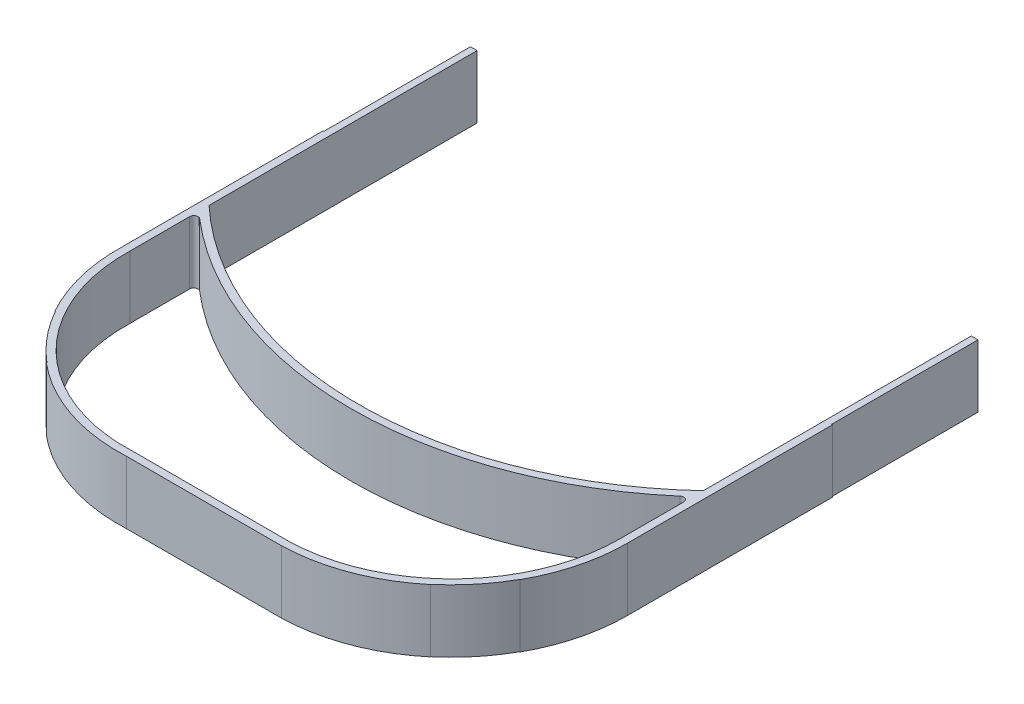
from build123d import *

# Parameters (mm, degrees)
EXTRUDE_THIN1_DEPTH = 19.05
CUT_EXTRUDE1_DEPTH  = 0.762
SKETCH5_W           = 0.254
SKETCH5_H           = 44.45
CUT_EXTRUDE2_DEPTH  = 179.757350667
FILLET1_R           = 1.27


# Read off the part's stored shape, not the designer's step: Extrude-Thin1
with BuildPart() as part:
    # Extrude-Thin1 outline → Extrude-Thin1 (new body)
    with BuildSketch(Plane(origin=(0, 0, 0), x_dir=(1, 0, 0), z_dir=(0, 1, 0))):
        with BuildLine():
            Line((-77.343, 0), (-77.343, -105.395106316))
            ThreePointArc((-77.343, -105.395106316), (-61.336250036, -144.849828705), (-21.528670477, -159.957699927))
            Line((-21.528670477, -159.957699927), (25.447975811, -159.957699927))
            ThreePointArc((25.447975811, -159.957699927), (62.222233314, -143.899011044), (77.343, -106.729266381))
            Line((77.343, -106.729266381), (77.343, 0))
            Line((77.343, 0), (75.057, 0))
            Line((75.057, 0), (75.057, -81.420653026))
            ThreePointArc((75.057, -81.420653026), (0, -111.057919203), (-75.057, -81.420653026))
            Line((-75.057, -81.420653026), (-75.057, 0))
            Line((-75.057, 0), (-77.343, 0))
        make_face()
        with BuildLine():
            ThreePointArc((-75.057, -84.523738539), (0, -113.343919203), (75.057, -84.523738539))
            Line((75.057, -84.523738539), (75.057, -106.729266381))
            ThreePointArc((75.057, -106.729266381), (60.595423897, -142.292928246), (25.418661536, -157.671699927))
            Line((25.418661536, -157.671699927), (-21.584839631, -157.671699927))
            ThreePointArc((-21.584839631, -157.671699927), (-59.729066599, -143.224119864), (-75.057, -105.425057993))
            Line((-75.057, -105.425057993), (-75.057, -84.523738539))
        make_face(mode=Mode.SUBTRACT)
    extrude(amount=EXTRUDE_THIN1_DEPTH)

    # Sketch4 → Cut-Extrude1 (cut, symmetric)
    # profile 1 of 11: a face of its own
    with BuildSketch(Plane.ZY.offset(77.343)):
        Polygon((64.086153846, 12.7), (66.561025641, 12.7), (66.561025641, 11.788205128), (64.997948718, 11.788205128), (64.997948718, 10.811282051), (66.561025641, 10.811282051), (66.561025641, 9.899487179), (64.997948718, 9.899487179), (64.997948718, 7.62), (64.086153846, 7.62), align=None)
    # profile 2 of 11: a face of its own
    with BuildSketch(Plane.ZY.offset(77.343)):
        with BuildLine():
            Line((67.472820513, 12.7), (68.535224359, 12.7))
            add(Edge.make_bspline(
                [(68.535224359, 12.7), (68.60544893, 12.699750743), (68.740510561, 12.699271352), (68.935262056, 12.691707827), (69.114168086, 12.681182562), (69.27749354, 12.665120728), (69.425168542, 12.643824678), (69.557341098, 12.618720159), (69.674007345, 12.590108177), (69.776151201, 12.55445539), (69.868330981, 12.514239587), (69.954255351, 12.468030891), (70.03581993, 12.416343853), (70.112479549, 12.357818444), (70.184900396, 12.293507524), (70.253219098, 12.223346356), (70.316470249, 12.146740004), (70.374262194, 12.064172522), (70.426934901, 11.977313424), (70.473486526, 11.886043452), (70.511342385, 11.790299134), (70.544792094, 11.691464182), (70.568884836, 11.588125732), (70.585640986, 11.481289801), (70.597909183, 11.370580314), (70.598614546, 11.295369204), (70.598974359, 11.257003205)],
                knots=[0, 0, 0, 0, 1.749336639, 3.364467119, 4.854658419, 6.213483162, 7.451590619, 8.570285859, 9.5643256, 10.440900261, 11.26203566, 12.067320669, 12.869050712, 13.665104639, 14.467235401, 15.27997916, 16.102287765, 16.939272006, 17.78853747, 18.631303466, 19.488103222, 20.351255419, 21.228522269, 22.127379805, 23.044756219, 24, 24, 24, 24], degree=3))
            add(Edge.make_bspline(
                [(70.598974359, 11.257003205), (70.598039694, 11.216957916), (70.596206986, 11.138436401), (70.586335024, 11.023094701), (70.568292179, 10.91274383), (70.540963665, 10.807706882), (70.509553088, 10.706676549), (70.467785077, 10.611516906), (70.42064575, 10.520843991), (70.364659747, 10.435940409), (70.303217844, 10.354920281), (70.231762204, 10.280887788), (70.154922054, 10.209863965), (70.06837793, 10.146297503), (69.975944776, 10.085890267), (69.875786044, 10.031145224), (69.768555404, 9.98068621), (69.693166953, 9.952546778), (69.654615385, 9.938157051)],
                knots=[0, 0, 0, 0, 1.099860209, 2.156625411, 3.176576793, 4.16617041, 5.135385252, 6.078461593, 7.016046972, 7.938469504, 8.868247731, 9.803980173, 10.76021508, 11.73834243, 12.748633912, 13.790971185, 14.870363756, 16, 16, 16, 16], degree=3))
            Line((69.654615385, 9.938157051), (70.826923077, 7.62))
            Line((70.826923077, 7.62), (69.813365385, 7.62))
            Line((69.813365385, 7.62), (68.693974359, 9.834358974))
            Line((68.693974359, 9.834358974), (68.384615385, 9.834358974))
            Line((68.384615385, 9.834358974), (68.384615385, 7.62))
            Line((68.384615385, 7.62), (67.472820513, 7.62))
            Line((67.472820513, 7.62), (67.472820513, 12.7))
        make_face()
        with BuildLine():
            Line((68.384615385, 10.746153846), (68.739767628, 10.746153846))
            add(Edge.make_bspline(
                [(68.739767628, 10.746153846), (68.783187942, 10.746642875), (68.866328514, 10.74757926), (68.985895575, 10.751922602), (69.094490982, 10.762387909), (69.19258108, 10.775610434), (69.280659449, 10.790877748), (69.357940462, 10.812756737), (69.425614901, 10.836200627), (69.48288082, 10.8653353), (69.531807506, 10.898467744), (69.574052568, 10.936107023), (69.608995291, 10.979669695), (69.637754935, 11.027971917), (69.660126811, 11.081440907), (69.676456566, 11.139489699), (69.685582485, 11.202779542), (69.686632453, 11.246458151), (69.687179487, 11.269214744)],
                knots=[0, 0, 0, 0, 1.688639943, 3.233382647, 4.650958383, 5.928841754, 7.082724185, 8.122798841, 9.049171256, 9.863274652, 10.613301712, 11.341792392, 12.054588806, 12.776240173, 13.521029143, 14.301969904, 15.115324896, 16, 16, 16, 16], degree=3))
            add(Edge.make_bspline(
                [(69.687179487, 11.269214744), (69.686145269, 11.296137453), (69.684113739, 11.349022128), (69.663954648, 11.425157516), (69.631865729, 11.495626026), (69.587880611, 11.560109265), (69.532487074, 11.616639723), (69.468918619, 11.666471773), (69.395803286, 11.705875229), (69.32810399, 11.731865329), (69.266513455, 11.747415474), (69.21092994, 11.759003304), (69.146563895, 11.767215932), (69.073366727, 11.775926886), (68.991525018, 11.781575499), (68.900592682, 11.78569786), (68.800830876, 11.787384521), (68.731287423, 11.787923717), (68.694991987, 11.788205128)],
                knots=[0, 0, 0, 0, 1.020303359, 2.004196876, 2.966617323, 3.9489082, 4.950758222, 5.960522915, 7.003732012, 8.091992268, 8.70421221, 9.413913587, 10.24622431, 11.166358409, 12.212345909, 13.359657661, 14.621978493, 16, 16, 16, 16], degree=3))
            Line((68.694991987, 11.788205128), (68.384615385, 11.788205128))
            Line((68.384615385, 11.788205128), (68.384615385, 10.746153846))
        make_face(mode=Mode.SUBTRACT)
    # profile 3 of 11: a face of its own
    with BuildSketch(Plane.ZY.offset(77.343)):
        Polygon((71.575897436, 12.7), (74.311282051, 12.7), (74.311282051, 11.788205128), (72.487692308, 11.788205128), (72.487692308, 10.811282051), (74.311282051, 10.811282051), (74.311282051, 9.899487179), (72.487692308, 9.899487179), (72.487692308, 8.531794872), (74.311282051, 8.531794872), (74.311282051, 7.62), (71.575897436, 7.62), align=None)
    # profile 4 of 11: a face of its own
    with BuildSketch(Plane.ZY.offset(77.343)):
        with BuildLine():
            Line((77.828205128, 12.021241987), (77.146394231, 11.397435897))
            add(Edge.make_bspline(
                [(77.146394231, 11.397435897), (77.117188375, 11.438633793), (77.061117206, 11.517728006), (76.970231689, 11.623637022), (76.879756567, 11.713985295), (76.788853642, 11.78839539), (76.696717186, 11.846415212), (76.603507135, 11.887493886), (76.509751921, 11.913607989), (76.44676289, 11.916859824), (76.415737179, 11.918461538)],
                knots=[0, 0, 0, 0, 1.299362458, 2.494594718, 3.587462134, 4.587049575, 5.512617175, 6.380583204, 7.202344345, 8, 8, 8, 8], degree=3))
            add(Edge.make_bspline(
                [(76.415737179, 11.918461538), (76.386797287, 11.917446618), (76.330921957, 11.915487075), (76.251267529, 11.896009355), (76.180549193, 11.862393671), (76.118835968, 11.818438335), (76.069949989, 11.765482347), (76.030918326, 11.709945132), (76.008940219, 11.648644606), (76.006047468, 11.606540932), (76.004615385, 11.585697115)],
                knots=[0, 0, 0, 0, 1.185010067, 2.2879431, 3.333075148, 4.379039566, 5.372662701, 6.27520591, 7.14612461, 8, 8, 8, 8], degree=3))
            add(Edge.make_bspline(
                [(76.004615385, 11.585697115), (76.005512799, 11.564552722), (76.007320066, 11.521970852), (76.024775808, 11.459561819), (76.051086595, 11.398580928), (76.076227627, 11.361458959), (76.089078526, 11.342483974)],
                knots=[0, 0, 0, 0, 0.967525499, 1.948461899, 2.951351359, 4, 4, 4, 4], degree=3))
            add(Edge.make_bspline(
                [(76.089078526, 11.342483974), (76.100761383, 11.327734918), (76.127653777, 11.293784537), (76.178932065, 11.240012426), (76.243326826, 11.174136884), (76.323316104, 11.098423176), (76.415579326, 11.010148343), (76.524393012, 10.912782501), (76.646625027, 10.803310344), (76.733504712, 10.727077898), (76.779030449, 10.68713141)],
                knots=[0, 0, 0, 0, 0.473873513, 1.090794244, 1.870441696, 2.795289791, 3.865433203, 5.087734844, 6.473946851, 8, 8, 8, 8], degree=3))
            add(Edge.make_bspline(
                [(76.779030449, 10.68713141), (76.821762901, 10.650148628), (76.902860219, 10.57996299), (77.018245597, 10.480345747), (77.119650127, 10.390722542), (77.208551041, 10.312438428), (77.283600689, 10.244672026), (77.34511458, 10.187099412), (77.393844001, 10.14084142), (77.421543823, 10.112901565), (77.433365385, 10.100977564)],
                knots=[0, 0, 0, 0, 1.543621617, 2.929473131, 4.163658386, 5.240097082, 6.164993805, 6.925417477, 7.541396219, 8, 8, 8, 8], degree=3))
            add(Edge.make_bspline(
                [(77.433365385, 10.100977564), (77.478213924, 10.052441839), (77.564428568, 9.95913913), (77.676477212, 9.814549275), (77.76869687, 9.673400093), (77.840039747, 9.533035635), (77.893920756, 9.391430721), (77.931907582, 9.245112497), (77.954658145, 9.092552029), (77.957183988, 8.988448135), (77.958461538, 8.935793269)],
                knots=[0, 0, 0, 0, 1.206664779, 2.319633467, 3.337109185, 4.282041471, 5.190008762, 6.099243693, 7.03861361, 8, 8, 8, 8], degree=3))
            add(Edge.make_bspline(
                [(77.958461538, 8.935793269), (77.957552211, 8.88448756), (77.955768076, 8.78382385), (77.93391585, 8.636517505), (77.902755858, 8.495538939), (77.854577044, 8.362422199), (77.795856991, 8.234982214), (77.722242923, 8.115204094), (77.635793295, 8.001875635), (77.536708747, 7.897022722), (77.427109472, 7.801875971), (77.309553833, 7.717174087), (77.182892311, 7.647241892), (77.048207085, 7.589657717), (76.905570246, 7.545305616), (76.755151719, 7.51252528), (76.596721429, 7.492851039), (76.488384513, 7.49079433), (76.433036859, 7.48974359)],
                knots=[0, 0, 0, 0, 1.043214005, 2.046824704, 3.02475056, 3.976699089, 4.921714032, 5.875962561, 6.831408892, 7.817874052, 8.806269674, 9.781291748, 10.760897367, 11.74438705, 12.757449933, 13.795994037, 14.874007457, 16, 16, 16, 16], degree=3))
            add(Edge.make_bspline(
                [(76.433036859, 7.48974359), (76.389589422, 7.490514376), (76.30353858, 7.492040975), (76.176712647, 7.504504388), (76.054247873, 7.524619009), (75.936282202, 7.553449271), (75.822284178, 7.589981122), (75.712249119, 7.634603379), (75.606936635, 7.68800767), (75.505549881, 7.74909579), (75.408581721, 7.820027144), (75.314806031, 7.899351564), (75.225154281, 7.988289095), (75.139195891, 8.086629403), (75.057480848, 8.194650964), (74.977334324, 8.310849378), (74.902318272, 8.43738113), (74.85597752, 8.526144178), (74.832307692, 8.571482372)],
                knots=[0, 0, 0, 0, 1.016823716, 2.013894106, 2.979844003, 3.91962641, 4.853723003, 5.779685073, 6.695824784, 7.614987388, 8.547259901, 9.504950863, 10.487499108, 11.500346958, 12.559593716, 13.656357062, 14.802919212, 16, 16, 16, 16], degree=3))
            Line((74.832307692, 8.571482372), (75.634198718, 9.052820513))
            add(Edge.make_bspline(
                [(75.634198718, 9.052820513), (75.663806135, 9.001355739), (75.720566083, 8.902693368), (75.816751121, 8.770127968), (75.915287782, 8.656607646), (76.018454146, 8.564138883), (76.124995747, 8.49148525), (76.235427207, 8.439561923), (76.349826113, 8.407421443), (76.427749451, 8.403496348), (76.46661859, 8.401538462)],
                knots=[0, 0, 0, 0, 1.283663364, 2.460892379, 3.537111102, 4.529833553, 5.449777664, 6.316464042, 7.160231139, 8, 8, 8, 8], degree=3))
            add(Edge.make_bspline(
                [(76.46661859, 8.401538462), (76.506154068, 8.403137378), (76.582858655, 8.406239509), (76.692344637, 8.434892954), (76.792725531, 8.479880966), (76.879494035, 8.544072654), (76.952964133, 8.61815962), (77.007189282, 8.700584756), (77.041253887, 8.789766764), (77.044855341, 8.851718453), (77.046666667, 8.882876603)],
                knots=[0, 0, 0, 0, 1.13588714, 2.203786484, 3.234766741, 4.283437687, 5.291419208, 6.222934724, 7.106237994, 8, 8, 8, 8], degree=3))
            add(Edge.make_bspline(
                [(77.046666667, 8.882876603), (77.044993982, 8.91186419), (77.041596083, 8.9707497), (77.016568206, 9.058302984), (76.977442001, 9.145816451), (76.931152941, 9.217597364), (76.884048027, 9.277697576), (76.839005104, 9.329771692), (76.784154739, 9.387304473), (76.719636009, 9.450368292), (76.646301374, 9.519518314), (76.56408906, 9.59474777), (76.472057647, 9.675393977), (76.407009663, 9.730329377), (76.372996795, 9.759054487)],
                knots=[0, 0, 0, 0, 0.916159276, 1.861089862, 2.860218735, 3.940849679, 4.552606315, 5.27541173, 6.11797699, 7.06649574, 8.129236253, 9.306560635, 10.591630461, 12, 12, 12, 12], degree=3))
            add(Edge.make_bspline(
                [(76.372996795, 9.759054487), (76.308336978, 9.813762893), (76.184235218, 9.918764882), (76.008863687, 10.073849514), (75.850838235, 10.218790313), (75.711523739, 10.355379064), (75.589145118, 10.481093289), (75.484531172, 10.596954088), (75.398831134, 10.703855168), (75.308650322, 10.830472343), (75.222960521, 10.984764071), (75.148900217, 11.170394906), (75.100853017, 11.356002187), (75.095469996, 11.480608693), (75.092820513, 11.541939103)],
                knots=[0, 0, 0, 0, 1.345494975, 2.582412109, 3.71882943, 4.751509156, 5.681369928, 6.505683931, 7.230279997, 7.856715994, 8.973648664, 10.023341002, 11.027102913, 12, 12, 12, 12], degree=3))
            add(Edge.make_bspline(
                [(75.092820513, 11.541939103), (75.093922429, 11.585431337), (75.096093323, 11.671115712), (75.115458033, 11.7971021), (75.144399329, 11.918668378), (75.186430399, 12.035371018), (75.240981654, 12.147063845), (75.307232033, 12.254293642), (75.386210281, 12.35607349), (75.475213434, 12.452335916), (75.573272121, 12.54030882), (75.67806029, 12.617953722), (75.788984831, 12.683533735), (75.905367162, 12.737937118), (76.027928457, 12.779579451), (76.155765813, 12.809097613), (76.289062589, 12.826654074), (76.379728178, 12.829040672), (76.425913462, 12.83025641)],
                knots=[0, 0, 0, 0, 1.010766082, 1.991317756, 2.957454644, 3.913069143, 4.869106762, 5.843196583, 6.838735724, 7.860187025, 8.887984031, 9.89767229, 10.887916223, 11.879572884, 12.879850636, 13.892031539, 14.926195476, 16, 16, 16, 16], degree=3))
            add(Edge.make_bspline(
                [(76.425913462, 12.83025641), (76.485767303, 12.828066829), (76.605002519, 12.823704951), (76.781295227, 12.789596488), (76.953490572, 12.735957338), (77.092248809, 12.671247604), (77.202656147, 12.608563255), (77.287273059, 12.550851402), (77.373375321, 12.484739372), (77.461657295, 12.41001883), (77.550478566, 12.325281942), (77.642364746, 12.232545936), (77.736063774, 12.131009356), (77.796953286, 12.058472095), (77.828205128, 12.021241987)],
                knots=[0, 0, 0, 0, 1.282922637, 2.555718331, 3.837320111, 5.142675274, 5.830281639, 6.55870424, 7.337177975, 8.157850921, 9.037902056, 9.96903443, 10.957596896, 12, 12, 12, 12], degree=3))
        make_face()
    # profile 5 of 11: a face of its own
    with BuildSketch(Plane.ZY.offset(77.343)):
        Polygon((78.87025641, 12.7), (79.691482372, 12.7), (81.996410256, 9.357091346), (81.996410256, 12.7), (82.908205128, 12.7), (82.908205128, 7.62), (82.080873397, 7.62), (79.782051282, 10.952732372), (79.782051282, 7.62), (78.87025641, 7.62), align=None)
    # profile 6 of 11: a face of its own
    with BuildSketch(Plane.ZY.offset(77.343)):
        with BuildLine():
            add(Edge.make_bspline(
                [(86.46786859, 12.83025641), (86.556190616, 12.827969595), (86.730558299, 12.823454903), (86.986990239, 12.785821425), (87.234109827, 12.724503068), (87.471805317, 12.639266117), (87.699481546, 12.527801922), (87.917941604, 12.393270565), (88.126402979, 12.233132849), (88.322729525, 12.051124521), (88.504170661, 11.853198413), (88.661389512, 11.640095768), (88.79545998, 11.417338291), (88.906577943, 11.184329097), (88.991214954, 10.939454486), (89.050608245, 10.683962995), (89.088765492, 10.417927308), (89.093154163, 10.236793266), (89.095384615, 10.144735577)],
                knots=[0, 0, 0, 0, 1.014329547, 2.002516266, 2.970391464, 3.935626869, 4.897733899, 5.877609409, 6.878433252, 7.912639331, 8.949961323, 9.958554974, 10.949718813, 11.932905612, 12.9188844, 13.919928257, 14.942845884, 16, 16, 16, 16], degree=3))
            add(Edge.make_bspline(
                [(89.095384615, 10.144735577), (89.09300928, 10.053715165), (89.088328606, 9.874356524), (89.052165991, 9.610772461), (88.991772509, 9.358017816), (88.908571008, 9.115520472), (88.799468305, 8.884455005), (88.668012357, 8.663346093), (88.510734292, 8.454245679), (88.333370657, 8.257265975), (88.138108687, 8.078464627), (87.931295264, 7.920896248), (87.713885324, 7.787378749), (87.486197086, 7.677973289), (87.247742283, 7.593067741), (86.999109928, 7.533160707), (86.740315405, 7.496753993), (86.56432258, 7.492103892), (86.474991987, 7.48974359)],
                knots=[0, 0, 0, 0, 1.051557043, 2.072126891, 3.067553643, 4.050577992, 5.02905126, 6.015227836, 7.017913613, 8.04756643, 9.074058332, 10.072836633, 11.047628519, 12.017157415, 12.98668631, 13.966869689, 14.968021931, 16, 16, 16, 16], degree=3))
            add(Edge.make_bspline(
                [(86.474991987, 7.48974359), (86.381562898, 7.491860897), (86.197987509, 7.496021117), (85.929324105, 7.535582908), (85.67192135, 7.595176785), (85.427941575, 7.684117449), (85.194900054, 7.795300758), (84.974509012, 7.932229669), (84.766842514, 8.094677896), (84.573091771, 8.278485081), (84.397553128, 8.479610455), (84.242605843, 8.692081578), (84.111904371, 8.914275356), (84.00544393, 9.146295781), (83.921514795, 9.386700903), (83.862312327, 9.636954858), (83.827340016, 9.896457445), (83.822468576, 10.072716791), (83.82, 10.162035256)],
                knots=[0, 0, 0, 0, 1.067978421, 2.098431617, 3.099715153, 4.085208694, 5.062210972, 6.048429807, 7.046490867, 8.072918869, 9.098532598, 10.095778865, 11.076610158, 12.041847152, 13.011192615, 13.984257998, 14.978533688, 16, 16, 16, 16], degree=3))
            add(Edge.make_bspline(
                [(83.82, 10.162035256), (83.820774781, 10.222124044), (83.822314533, 10.341540759), (83.840862468, 10.518510233), (83.867566162, 10.692025501), (83.907059658, 10.861394755), (83.955034161, 11.027812816), (84.017191907, 11.189730622), (84.087944244, 11.348877903), (84.170611687, 11.503374929), (84.262529891, 11.651800198), (84.362820835, 11.793453563), (84.4717367, 11.926622227), (84.588926631, 12.05218132), (84.714794481, 12.169305533), (84.847684588, 12.279652922), (84.990174247, 12.380292268), (85.139144806, 12.473681385), (85.293756403, 12.558131543), (85.453379628, 12.630012993), (85.614725929, 12.692785838), (85.779950674, 12.742328943), (85.947283185, 12.782681284), (86.118511073, 12.809366979), (86.292087389, 12.827914401), (86.409135802, 12.829473888), (86.46786859, 12.83025641)],
                knots=[0, 0, 0, 0, 1.034744296, 2.056386356, 3.06226378, 4.057406941, 5.050368692, 6.043467995, 7.042652155, 8.049140477, 9.059438543, 10.048523776, 11.036952808, 12.020949711, 13.004946614, 13.997082645, 14.994316842, 16.007702937, 17.024872941, 18.026463647, 19.021641123, 20.005082605, 20.995858141, 21.984425357, 22.988620895, 24, 24, 24, 24], degree=3))
        make_face()
        with BuildLine():
            add(Edge.make_bspline(
                [(86.453621795, 11.918461538), (86.394181083, 11.916866611), (86.276868904, 11.913718862), (86.104793302, 11.88973727), (85.939594647, 11.851435943), (85.782188701, 11.795956939), (85.631893253, 11.725346248), (85.488441875, 11.639850591), (85.353821072, 11.536531152), (85.226235806, 11.42093469), (85.110983513, 11.292133665), (85.009154476, 11.154101463), (84.923939974, 11.007068593), (84.852572294, 10.852400958), (84.798848249, 10.68835936), (84.760582222, 10.516228755), (84.736399521, 10.335712553), (84.733351262, 10.212654893), (84.731794872, 10.149823718)],
                knots=[0, 0, 0, 0, 1.033739768, 2.040188636, 3.016340934, 3.979330865, 4.937572243, 5.900995986, 6.878200029, 7.884839167, 8.891893314, 9.879764717, 10.863503415, 11.843163062, 12.837761627, 13.859916423, 14.907309254, 16, 16, 16, 16], degree=3))
            add(Edge.make_bspline(
                [(84.731794872, 10.149823718), (84.733858407, 10.080192642), (84.737902595, 9.943727271), (84.766357994, 9.744655264), (84.815042348, 9.556651512), (84.885341609, 9.380635512), (84.972531136, 9.214652738), (85.08080669, 9.060737547), (85.208414721, 8.917968364), (85.306722914, 8.834613768), (85.35661859, 8.792307692)],
                knots=[0, 0, 0, 0, 1.078454662, 2.113592447, 3.107694534, 4.079536787, 5.043276885, 6.005368276, 6.987637804, 8, 8, 8, 8], degree=3))
            add(Edge.make_bspline(
                [(85.35661859, 8.792307692), (85.397492674, 8.761053588), (85.478319942, 8.69924954), (85.60733786, 8.620034974), (85.740200911, 8.552140189), (85.877911713, 8.497282005), (86.020179427, 8.45413148), (86.166984546, 8.423913877), (86.318119057, 8.404949718), (86.420323296, 8.402683142), (86.471939103, 8.401538462)],
                knots=[0, 0, 0, 0, 1.023928204, 2.024787132, 3.009472467, 3.9914905, 4.972207045, 5.96565515, 6.972602802, 8, 8, 8, 8], degree=3))
            add(Edge.make_bspline(
                [(86.471939103, 8.401538462), (86.53035773, 8.403146913), (86.645298216, 8.40631159), (86.814170538, 8.429997955), (86.975955351, 8.470083836), (87.13165703, 8.525076158), (87.2808266, 8.596573428), (87.422735029, 8.684720892), (87.557631121, 8.788436212), (87.685053845, 8.905550709), (87.801524238, 9.034859121), (87.903140778, 9.173627573), (87.991064676, 9.318798581), (88.060948264, 9.472426822), (88.116794825, 9.633062115), (88.1546003, 9.801415881), (88.178987289, 9.976794101), (88.182036408, 10.096145177), (88.183589744, 10.156947115)],
                knots=[0, 0, 0, 0, 1.026359118, 2.019393844, 2.989460624, 3.950973911, 4.916101784, 5.890408035, 6.881132271, 7.902007068, 8.92769091, 9.933912415, 10.920395702, 11.90457117, 12.894218921, 13.903490204, 14.931958862, 16, 16, 16, 16], degree=3))
            add(Edge.make_bspline(
                [(88.183589744, 10.156947115), (88.181982662, 10.217399426), (88.178819367, 10.336390579), (88.155091313, 10.511317903), (88.115259647, 10.678928436), (88.060102188, 10.839495905), (87.989669034, 10.993177724), (87.902571294, 11.139433459), (87.799114583, 11.278121714), (87.68167995, 11.408297384), (87.553859571, 11.527920486), (87.416631621, 11.631731593), (87.273835894, 11.721940144), (87.122195959, 11.792605881), (86.964814242, 11.848905123), (86.800730392, 11.890364693), (86.629322929, 11.91355039), (86.512710889, 11.916809897), (86.453621795, 11.918461538)],
                knots=[0, 0, 0, 0, 1.055025985, 2.07665775, 3.074803781, 4.057872707, 5.035505728, 6.020516407, 7.023567878, 8.050795229, 9.077271434, 10.074415901, 11.050397877, 12.019801805, 12.988065821, 13.964604439, 14.968634123, 16, 16, 16, 16], degree=3))
        make_face(mode=Mode.SUBTRACT)
    # profile 7 of 11: a face of its own
    with BuildSketch(Plane.ZY.offset(77.343)):
        with BuildLine():
            Line((94.566153846, 12.021241987), (93.884342949, 11.397435897))
            add(Edge.make_bspline(
                [(93.884342949, 11.397435897), (93.855137093, 11.438633793), (93.799065924, 11.517728006), (93.708180407, 11.623637022), (93.617705285, 11.713985295), (93.52680236, 11.78839539), (93.434665904, 11.846415212), (93.341455853, 11.887493886), (93.247700639, 11.913607989), (93.184711608, 11.916859824), (93.153685897, 11.918461538)],
                knots=[0, 0, 0, 0, 1.299362458, 2.494594718, 3.587462134, 4.587049575, 5.512617175, 6.380583204, 7.202344345, 8, 8, 8, 8], degree=3))
            add(Edge.make_bspline(
                [(93.153685897, 11.918461538), (93.124746005, 11.917446618), (93.068870675, 11.915487075), (92.989216247, 11.896009355), (92.918497911, 11.862393671), (92.856784686, 11.818438335), (92.807898707, 11.765482347), (92.768867044, 11.709945132), (92.746888937, 11.648644606), (92.743996186, 11.606540932), (92.742564103, 11.585697115)],
                knots=[0, 0, 0, 0, 1.185010067, 2.2879431, 3.333075148, 4.379039566, 5.372662701, 6.27520591, 7.14612461, 8, 8, 8, 8], degree=3))
            add(Edge.make_bspline(
                [(92.742564103, 11.585697115), (92.743461517, 11.564552722), (92.745268784, 11.521970852), (92.762724526, 11.459561819), (92.789035313, 11.398580928), (92.814176345, 11.361458959), (92.827027244, 11.342483974)],
                knots=[0, 0, 0, 0, 0.967525499, 1.948461899, 2.951351359, 4, 4, 4, 4], degree=3))
            add(Edge.make_bspline(
                [(92.827027244, 11.342483974), (92.838710101, 11.327734918), (92.865602495, 11.293784537), (92.916880783, 11.240012426), (92.981275543, 11.174136884), (93.061264822, 11.098423176), (93.153528044, 11.010148343), (93.26234173, 10.912782501), (93.384573745, 10.803310344), (93.47145343, 10.727077898), (93.516979167, 10.68713141)],
                knots=[0, 0, 0, 0, 0.473873513, 1.090794244, 1.870441696, 2.795289791, 3.865433203, 5.087734844, 6.473946851, 8, 8, 8, 8], degree=3))
            add(Edge.make_bspline(
                [(93.516979167, 10.68713141), (93.559711619, 10.650148628), (93.640808937, 10.57996299), (93.756194314, 10.480345747), (93.857598844, 10.390722542), (93.946499759, 10.312438428), (94.021549407, 10.244672026), (94.083063298, 10.187099412), (94.131792718, 10.14084142), (94.159492541, 10.112901565), (94.171314103, 10.100977564)],
                knots=[0, 0, 0, 0, 1.543621617, 2.929473131, 4.163658386, 5.240097082, 6.164993805, 6.925417477, 7.541396219, 8, 8, 8, 8], degree=3))
            add(Edge.make_bspline(
                [(94.171314103, 10.100977564), (94.216162642, 10.052441839), (94.302377286, 9.95913913), (94.41442593, 9.814549275), (94.506645588, 9.673400093), (94.577988465, 9.533035635), (94.631869474, 9.391430721), (94.6698563, 9.245112497), (94.692606863, 9.092552029), (94.695132706, 8.988448135), (94.696410256, 8.935793269)],
                knots=[0, 0, 0, 0, 1.206664779, 2.319633467, 3.337109185, 4.282041471, 5.190008762, 6.099243693, 7.03861361, 8, 8, 8, 8], degree=3))
            add(Edge.make_bspline(
                [(94.696410256, 8.935793269), (94.695500929, 8.88448756), (94.693716794, 8.78382385), (94.671864568, 8.636517505), (94.640704576, 8.495538939), (94.592525762, 8.362422199), (94.533805709, 8.234982214), (94.460191641, 8.115204094), (94.373742013, 8.001875635), (94.274657465, 7.897022722), (94.16505819, 7.801875971), (94.04750255, 7.717174087), (93.920841029, 7.647241892), (93.786155803, 7.589657717), (93.643518964, 7.545305616), (93.493100437, 7.51252528), (93.334670147, 7.492851039), (93.226333231, 7.49079433), (93.170985577, 7.48974359)],
                knots=[0, 0, 0, 0, 1.043214005, 2.046824704, 3.02475056, 3.976699089, 4.921714032, 5.875962561, 6.831408892, 7.817874052, 8.806269674, 9.781291748, 10.760897367, 11.74438705, 12.757449933, 13.795994037, 14.874007457, 16, 16, 16, 16], degree=3))
            add(Edge.make_bspline(
                [(93.170985577, 7.48974359), (93.12753814, 7.490514376), (93.041487298, 7.492040975), (92.914661365, 7.504504388), (92.792196591, 7.524619009), (92.67423092, 7.553449271), (92.560232896, 7.589981122), (92.450197837, 7.634603379), (92.344885353, 7.68800767), (92.243498599, 7.74909579), (92.146530439, 7.820027144), (92.052754749, 7.899351564), (91.963102999, 7.988289095), (91.877144609, 8.086629403), (91.795429566, 8.194650964), (91.715283042, 8.310849378), (91.64026699, 8.43738113), (91.593926238, 8.526144178), (91.57025641, 8.571482372)],
                knots=[0, 0, 0, 0, 1.016823716, 2.013894106, 2.979844003, 3.91962641, 4.853723003, 5.779685073, 6.695824784, 7.614987388, 8.547259901, 9.504950863, 10.487499108, 11.500346958, 12.559593716, 13.656357062, 14.802919212, 16, 16, 16, 16], degree=3))
            Line((91.57025641, 8.571482372), (92.372147436, 9.052820513))
            add(Edge.make_bspline(
                [(92.372147436, 9.052820513), (92.401754852, 9.001355739), (92.4585148, 8.902693368), (92.554699839, 8.770127968), (92.6532365, 8.656607646), (92.756402864, 8.564138883), (92.862944465, 8.49148525), (92.973375925, 8.439561923), (93.087774831, 8.407421443), (93.165698169, 8.403496348), (93.204567308, 8.401538462)],
                knots=[0, 0, 0, 0, 1.283663364, 2.460892379, 3.537111102, 4.529833553, 5.449777664, 6.316464042, 7.160231139, 8, 8, 8, 8], degree=3))
            add(Edge.make_bspline(
                [(93.204567308, 8.401538462), (93.244102786, 8.403137378), (93.320807373, 8.406239509), (93.430293355, 8.434892954), (93.530674249, 8.479880966), (93.617442753, 8.544072654), (93.690912851, 8.61815962), (93.745138, 8.700584756), (93.779202605, 8.789766764), (93.782804059, 8.851718453), (93.784615385, 8.882876603)],
                knots=[0, 0, 0, 0, 1.13588714, 2.203786484, 3.234766741, 4.283437687, 5.291419208, 6.222934724, 7.106237994, 8, 8, 8, 8], degree=3))
            add(Edge.make_bspline(
                [(93.784615385, 8.882876603), (93.7829427, 8.91186419), (93.779544801, 8.9707497), (93.754516924, 9.058302984), (93.715390719, 9.145816451), (93.669101659, 9.217597364), (93.621996745, 9.277697576), (93.576953822, 9.329771692), (93.522103457, 9.387304473), (93.457584727, 9.450368292), (93.384250092, 9.519518314), (93.302037778, 9.59474777), (93.210006365, 9.675393977), (93.144958381, 9.730329377), (93.110945513, 9.759054487)],
                knots=[0, 0, 0, 0, 0.916159276, 1.861089862, 2.860218735, 3.940849679, 4.552606315, 5.27541173, 6.11797699, 7.06649574, 8.129236253, 9.306560635, 10.591630461, 12, 12, 12, 12], degree=3))
            add(Edge.make_bspline(
                [(93.110945513, 9.759054487), (93.046285696, 9.813762893), (92.922183936, 9.918764882), (92.746812405, 10.073849514), (92.588786953, 10.218790313), (92.449472457, 10.355379064), (92.327093836, 10.481093289), (92.22247989, 10.596954088), (92.136779852, 10.703855168), (92.04659904, 10.830472343), (91.960909239, 10.984764071), (91.886848934, 11.170394906), (91.838801735, 11.356002187), (91.833418714, 11.480608693), (91.830769231, 11.541939103)],
                knots=[0, 0, 0, 0, 1.345494975, 2.582412109, 3.71882943, 4.751509156, 5.681369928, 6.505683931, 7.230279997, 7.856715994, 8.973648664, 10.023341002, 11.027102913, 12, 12, 12, 12], degree=3))
            add(Edge.make_bspline(
                [(91.830769231, 11.541939103), (91.831871147, 11.585431337), (91.834042041, 11.671115712), (91.853406751, 11.7971021), (91.882348047, 11.918668378), (91.924379117, 12.035371018), (91.978930372, 12.147063845), (92.045180751, 12.254293642), (92.124158999, 12.35607349), (92.213162152, 12.452335916), (92.311220839, 12.54030882), (92.416009008, 12.617953722), (92.526933549, 12.683533735), (92.64331588, 12.737937118), (92.765877175, 12.779579451), (92.893714531, 12.809097613), (93.027011307, 12.826654074), (93.117676896, 12.829040672), (93.163862179, 12.83025641)],
                knots=[0, 0, 0, 0, 1.010766082, 1.991317756, 2.957454644, 3.913069143, 4.869106762, 5.843196583, 6.838735724, 7.860187025, 8.887984031, 9.89767229, 10.887916223, 11.879572884, 12.879850636, 13.892031539, 14.926195476, 16, 16, 16, 16], degree=3))
            add(Edge.make_bspline(
                [(93.163862179, 12.83025641), (93.223716021, 12.828066829), (93.342951237, 12.823704951), (93.519243944, 12.789596488), (93.69143929, 12.735957338), (93.830197527, 12.671247604), (93.940604865, 12.608563255), (94.025221777, 12.550851402), (94.111324039, 12.484739372), (94.199606013, 12.41001883), (94.288427284, 12.325281942), (94.380313464, 12.232545936), (94.474012492, 12.131009356), (94.534902004, 12.058472095), (94.566153846, 12.021241987)],
                knots=[0, 0, 0, 0, 1.282922637, 2.555718331, 3.837320111, 5.142675274, 5.830281639, 6.55870424, 7.337177975, 8.157850921, 9.037902056, 9.96903443, 10.957596896, 12, 12, 12, 12], degree=3))
        make_face()
    # profile 8 of 11: a face of its own
    with BuildSketch(Plane.ZY.offset(77.343)):
        Polygon((95.087179487, 12.7), (97.822564103, 12.7), (97.822564103, 11.788205128), (96.910769231, 11.788205128), (96.910769231, 7.62), (95.998974359, 7.62), (95.998974359, 11.788205128), (95.087179487, 11.788205128), align=None)
    # profile 9 of 11: a face of its own
    with BuildSketch(Plane.ZY.offset(77.343)):
        Polygon((100.10306891, 12.7), (100.948717949, 12.7), (103.00025641, 7.62), (102.026386218, 7.62), (101.631546474, 8.662051282), (99.418205128, 8.662051282), (99.023365385, 7.62), (98.050512821, 7.62), align=None)
        Polygon((100.525384615, 11.337395833), (99.764198718, 9.573846154), (101.286570513, 9.573846154), align=None, mode=Mode.SUBTRACT)
    # profile 10 of 11: a face of its own
    with BuildSketch(Plane.ZY.offset(77.343)):
        Polygon((103.228205128, 12.7), (105.963589744, 12.7), (105.963589744, 11.788205128), (105.051794872, 11.788205128), (105.051794872, 7.62), (104.14, 7.62), (104.14, 11.788205128), (103.228205128, 11.788205128), align=None)
    # profile 11 of 11: a face of its own
    with BuildSketch(Plane.ZY.offset(77.343)):
        Polygon((106.68, 12.7), (109.415384615, 12.7), (109.415384615, 11.788205128), (107.591794872, 11.788205128), (107.591794872, 10.811282051), (109.415384615, 10.811282051), (109.415384615, 9.899487179), (107.591794872, 9.899487179), (107.591794872, 8.531794872), (109.415384615, 8.531794872), (109.415384615, 7.62), (106.68, 7.62), align=None)
    extrude(amount=CUT_EXTRUDE1_DEPTH, both=True, mode=Mode.SUBTRACT)

    # Sketch5 → Cut-Extrude2 (cut, through all)
    with BuildSketch(Plane(origin=(0, 19.05, 0), x_dir=(1, 0, 0), z_dir=(0, 1, 0))):
        with Locations((-77.216, -22.225)):
            Rectangle(SKETCH5_W, SKETCH5_H)
        with BuildLine():
            ThreePointArc((-70.658362695, -132.636850795), (-65.185958917, -140.661469423), (-58.346870442, -147.558467035))
            Line((-58.346870441, -147.558467034), (-58.265222194, -147.461191325))
            ThreePointArc((-58.265222194, -147.461191325), (-65.087998245, -140.580644261), (-70.547349382, -132.575165755))
            Line((-70.547349382, -132.575165755), (-70.658362695, -132.636850795))
        make_face()
    cut_extrude2 = extrude(amount=-CUT_EXTRUDE2_DEPTH, mode=Mode.SUBTRACT)

    # Mirror1: Cut-Extrude2 across plane
    add(cut_extrude2.mirror(Plane(origin=(0, 0, 0), x_dir=(0, 0, 1), z_dir=(1, 0, 0))), mode=Mode.SUBTRACT)

    # Fillet1
    fillet1_edges = [part.edges().sort_by_distance(p)[0] for p in [
        (-75.057, 9.525, 84.523738539),
        (75.057, 9.525, 84.523738539),
    ]]
    fillet(fillet1_edges, radius=FILLET1_R)


solid = part.part
